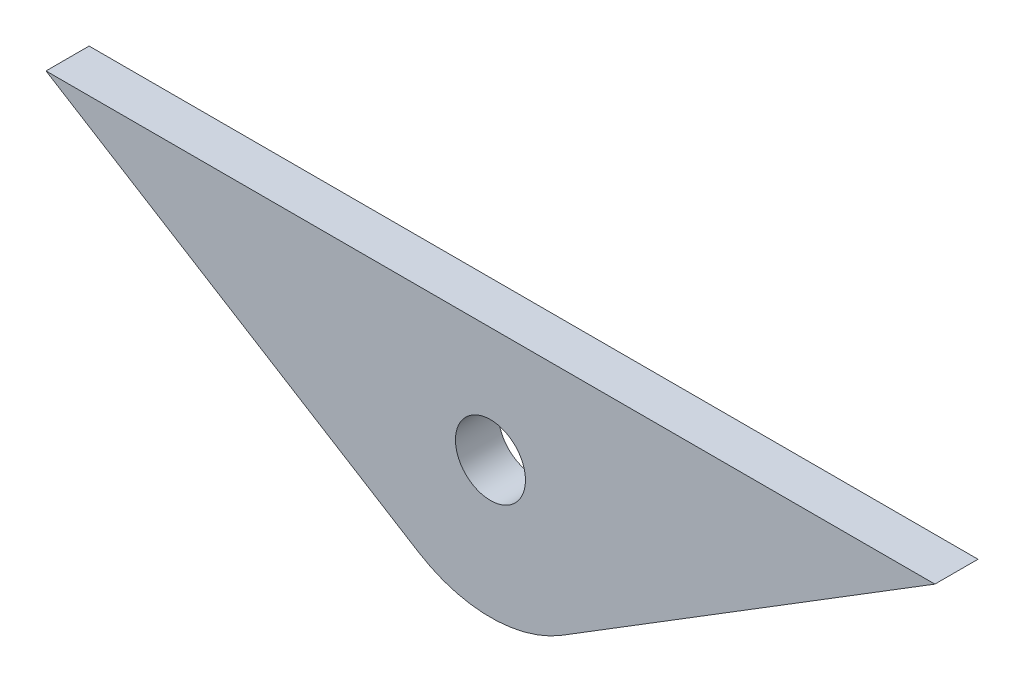
from build123d import *

# Parameters (mm, degrees)
SKETCH_1_R             = 3.25
SM_BASE_FLANGE_1_DEPTH = 4


# Sheet-metal steps are written as plain solids
with BuildPart() as part:
    # Sketch 1 → Базовая кромка1 (new body)
    with BuildSketch(Plane.XY):
        with BuildLine():
            Line((-82.501667048, 0), (-47.907304338, -21.407039383))
            ThreePointArc((-47.907304338, -21.407039383), (-41.250833524, -23.3), (-34.594362709, -21.407039383))
            Line((-34.594362709, -21.407039383), (0, 0))
            Line((0, 0), (-82.501667048, 0))
        make_face()
        with Locations((-41.250833524, -10.65)):
            Circle(SKETCH_1_R, mode=Mode.SUBTRACT)
    extrude(amount=-SM_BASE_FLANGE_1_DEPTH)


solid = part.part
